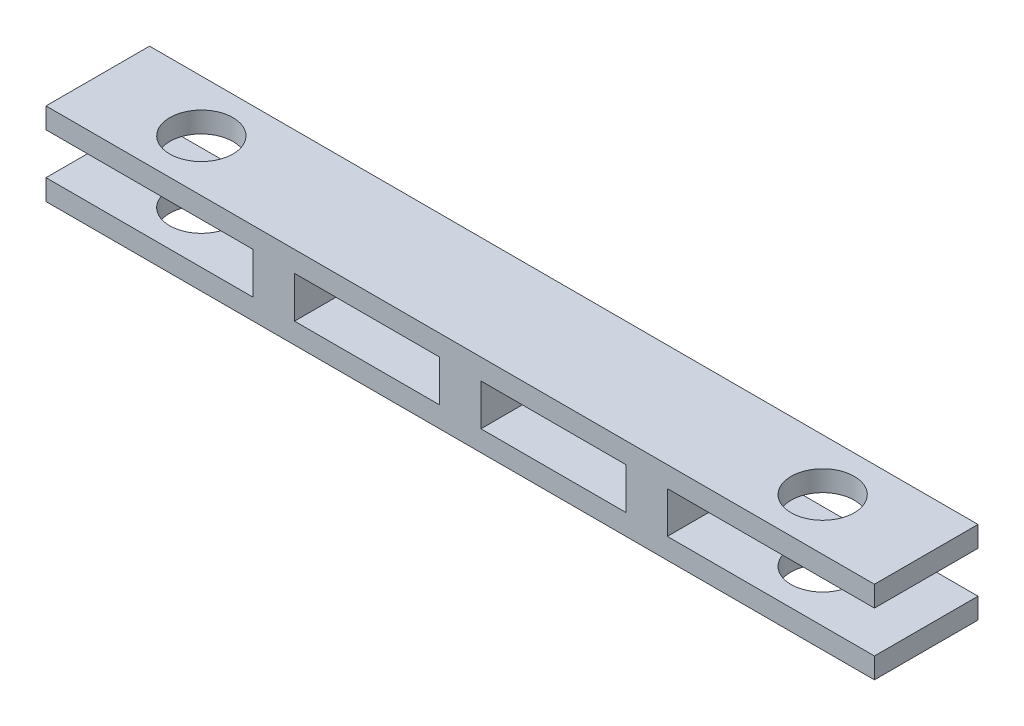
from build123d import *

# Parameters (mm, degrees)
SKETCH1_W           = 40
SKETCH1_H           = 5
BOSS_EXTRUDE1_DEPTH = 4
SKETCH2_R           = 1.525
CUT_EXTRUDE1_DEPTH  = 41.509258201
SKETCH3_W           = 10
SKETCH3_H           = 2
SKETCH3_W_2         = 7
CUT_EXTRUDE2_DEPTH  = 41.509258201


with BuildPart() as part:
    # Sketch1 → Boss-Extrude1 (new body)
    with BuildSketch(Plane(origin=(0, 0, 0), x_dir=(1, 0, 0), z_dir=(0, 1, 0))):
        with Locations((20, 2.5)):
            Rectangle(SKETCH1_W, SKETCH1_H)
    extrude(amount=BOSS_EXTRUDE1_DEPTH)

    # Sketch2 → Cut-Extrude1 (cut, through all)
    with BuildSketch(Plane(origin=(0, 4, 0), x_dir=(1, 0, 0), z_dir=(0, 1, 0))):
        with Locations((5, 2.5)):
            Circle(SKETCH2_R)
        with Locations((35, 2.5)):
            Circle(SKETCH2_R)
    extrude(amount=-CUT_EXTRUDE1_DEPTH, mode=Mode.SUBTRACT)

    # Sketch3 → Cut-Extrude2 (cut, through all)
    with BuildSketch(Plane(origin=(0, 0, -5), x_dir=(-1, 0, 0), z_dir=(0, 0, -1))):
        with Locations((-35, 2)):
            Rectangle(SKETCH3_W, SKETCH3_H)
        with Locations((-24.5, 2)):
            Rectangle(SKETCH3_W_2, SKETCH3_H)
        with Locations((-15.5, 2)):
            Rectangle(SKETCH3_W_2, SKETCH3_H)
        with Locations((-5, 2)):
            Rectangle(SKETCH3_W, SKETCH3_H)
    extrude(amount=-CUT_EXTRUDE2_DEPTH, mode=Mode.SUBTRACT)


solid = part.part
